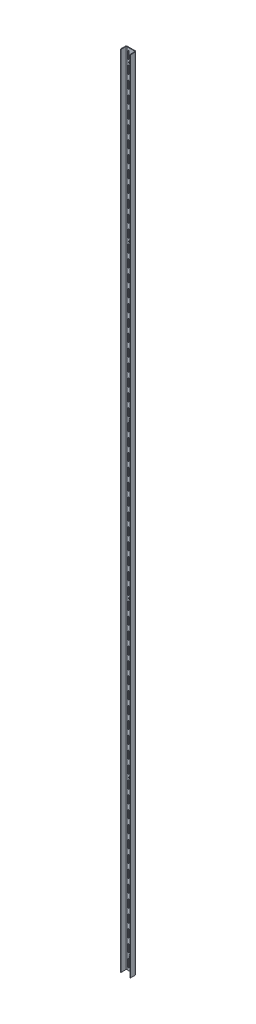
from build123d import *
from build123d.topology import SkipClean

# Parameters (mm, degrees)
BOSS_EXTRUDE1_DEPTH = 1984
CUT_EXTRUDE1_DEPTH  = 1985.096078823
CUT_EXTRUDE2_DEPTH  = 1985.096078823
BOSS_EXTRUDE2_DEPTH = 2
FILLET3_R           = 2
LPATTERN1_COUNT     = 62
LPATTERN1_PITCH     = 32
LPATTERN4_ANGLE     = 180
LPATTERN4_2_ANGLE   = 180
LPATTERN4_3_ANGLE   = 180
LPATTERN4_4_ANGLE   = 180
LPATTERN4_5_ANGLE   = 180
LPATTERN4_6_ANGLE   = 180
LPATTERN4_7_ANGLE   = 180
LPATTERN4_8_ANGLE   = 180
LPATTERN4_9_ANGLE   = 180
LPATTERN4_10_ANGLE  = 180


with BuildPart() as part:
    # Sketch1 → Boss-Extrude1 (new body)
    with BuildSketch(Plane(origin=(0, 0, 0), x_dir=(1, 0, 0), z_dir=(0, 1, 0))):
        with BuildLine():
            Line((11, -15), (11, -3))
            ThreePointArc((11, -3), (10.560660172, -1.939339828), (9.5, -1.5))
            Line((9.5, -1.5), (0, -1.5))
            Line((0, -1.5), (0, 0))
            Line((0, 0), (9.5, 0))
            ThreePointArc((9.5, 0), (11.621320344, -0.878679656), (12.5, -3))
            Line((12.5, -3), (12.5, -15))
            Line((12.5, -15), (11, -15))
        make_face()
    extrude(amount=BOSS_EXTRUDE1_DEPTH)

    # Sketch2 → Cut-Extrude1 (cut, through all)
    with BuildSketch(Plane.XY):
        with BuildLine():
            Line((4, 24.5), (4, 7.5))
            ThreePointArc((4, 7.5), (5.5, 6), (7, 7.5))
            Line((7, 7.5), (7, 24.5))
            ThreePointArc((7, 24.5), (5.5, 26), (4, 24.5))
        make_face()
    cut_extrude1 = extrude(amount=CUT_EXTRUDE1_DEPTH, mode=Mode.SUBTRACT)

    # Sketch2<3> → Cut-Extrude2 (cut, through all)
    with BuildSketch(Plane.XY):
        with BuildLine():
            ThreePointArc((0, 29.25), (2.75, 32), (0, 34.75))
            Line((0, 34.75), (0, 29.25))
        make_face()
    extrude(amount=CUT_EXTRUDE2_DEPTH, mode=Mode.SUBTRACT)

    # Sketch2<4> → Boss-Extrude2 (add)
    with BuildSketch(Plane.XY):
        with BuildLine():
            ThreePointArc((0, 27.75), (4.25, 32), (0, 36.25))
            Line((0, 36.25), (0, 34.75))
            ThreePointArc((0, 34.75), (2.75, 32), (0, 29.25))
            Line((0, 29.25), (0, 27.75))
        make_face()
    extrude(amount=BOSS_EXTRUDE2_DEPTH)

    # Fillet3
    # the kernel refuses this fillet: 2 mm, written as the material it adds along each edge
    with BuildSketch(Plane(origin=(0, 32, 1.5), x_dir=(0, 1, 0), z_dir=(-1, 0, 0))) as fillet3_piece_1:
        with BuildLine():
            CenterArc((5.572875656, -2), FILLET3_R, 90, 41.409622109)
            Line((5.572875656, 0), (4.25, 0))
            Line((4.25, 0), (4.25, -0.5))
        make_face()
    revolve(axis=Axis((0, 32, 1.5), (0, 0, -1)), revolution_arc=180)
    # the kernel refuses this fillet: 2 mm, written as the material it takes off along each edge
    with BuildSketch(Plane(origin=(0, 32, 0), x_dir=(-0.9999950652018582, -0.00314158748587966, 0), z_dir=(-0.00314158748587966, 0.9999950652018582, 0))) as fillet3_2_piece_1:
        with BuildLine():
            CenterArc((2.75 + FILLET3_R, FILLET3_R), FILLET3_R, 180, 90)
            Line((2.75, FILLET3_R), (2.75, 0))
            Line((2.75, 0), (2.75 + FILLET3_R, 0))
        make_face()
    revolve(axis=Axis((0, 32, 0), (0, 0, 1)), revolution_arc=359.64, mode=Mode.SUBTRACT)

    # LPattern1: Cut-Extrude1 ×62
    with Locations(*[(0, i * LPATTERN1_PITCH, 0) for i in range(1, LPATTERN1_COUNT)]):
        add(cut_extrude1, mode=Mode.SUBTRACT)

    # LPattern4: read off the stored shape, not the designer's step
    # LPattern4 outline → LPattern4 (revolve)
    with BuildSketch(Plane(origin=(0, 416, 0), x_dir=(0, -1, 0), z_dir=(-1, 0, 0))):
        with BuildLine():
            ThreePointArc((5.572875656, 1.5), (4.865768875, 1.629171307), (4.25, 2))
            Line((4.25, 2), (2.75, 2))
            ThreePointArc((2.75, 2), (2.765940608, 1.747991415), (2.813508327, 1.5))
            Line((2.813508327, 1.5), (5.572875656, 1.5))
        make_face()
    revolve(axis=Axis((0, 416, 0), (0, 0, 1)), revolution_arc=LPATTERN4_ANGLE)

    # LPattern4 2 outline → LPattern4 2 (revolve)
    with BuildSketch(Plane(origin=(0, 800, 0), x_dir=(0, -1, 0), z_dir=(-1, 0, 0))):
        with BuildLine():
            ThreePointArc((5.572875656, 1.5), (4.865768875, 1.629171307), (4.25, 2))
            Line((4.25, 2), (2.75, 2))
            ThreePointArc((2.75, 2), (2.765940608, 1.747991415), (2.813508327, 1.5))
            Line((2.813508327, 1.5), (5.572875656, 1.5))
        make_face()
    revolve(axis=Axis((0, 800, 0), (0, 0, 1)), revolution_arc=LPATTERN4_2_ANGLE)

    # LPattern4 3 outline → LPattern4 3 (revolve)
    with BuildSketch(Plane(origin=(0, 1184, 0), x_dir=(0, -1, 0), z_dir=(-1, 0, 0))):
        with BuildLine():
            ThreePointArc((5.572875656, 1.5), (4.865768875, 1.629171307), (4.25, 2))
            Line((4.25, 2), (2.75, 2))
            ThreePointArc((2.75, 2), (2.765940608, 1.747991415), (2.813508327, 1.5))
            Line((2.813508327, 1.5), (5.572875656, 1.5))
        make_face()
    revolve(axis=Axis((0, 1184, 0), (0, 0, 1)), revolution_arc=LPATTERN4_3_ANGLE)

    # LPattern4 4 outline → LPattern4 4 (revolve)
    with BuildSketch(Plane(origin=(0, 1568, 0), x_dir=(0, -1, 0), z_dir=(-1, 0, 0))):
        with BuildLine():
            ThreePointArc((5.572875656, 1.5), (4.865768875, 1.629171307), (4.25, 2))
            Line((4.25, 2), (2.75, 2))
            ThreePointArc((2.75, 2), (2.765940608, 1.747991415), (2.813508327, 1.5))
            Line((2.813508327, 1.5), (5.572875656, 1.5))
        make_face()
    revolve(axis=Axis((0, 1568, 0), (0, 0, 1)), revolution_arc=LPATTERN4_4_ANGLE)

    # LPattern4 5 outline → LPattern4 5 (revolve)
    with BuildSketch(Plane(origin=(0, 1952, 0), x_dir=(0, -1, 0), z_dir=(-1, 0, 0))):
        with BuildLine():
            ThreePointArc((5.572875656, 1.5), (4.865768875, 1.629171307), (4.25, 2))
            Line((4.25, 2), (2.75, 2))
            ThreePointArc((2.75, 2), (2.765940608, 1.747991415), (2.813508327, 1.5))
            Line((2.813508327, 1.5), (5.572875656, 1.5))
        make_face()
    revolve(axis=Axis((0, 1952, 0), (0, 0, 1)), revolution_arc=LPATTERN4_5_ANGLE)

    # LPattern4 6 outline → LPattern4 6 (revolve, cut)
    with BuildSketch(Plane(origin=(0, 416, 0), x_dir=(0, -1, 0), z_dir=(-1, 0, 0))):
        with BuildLine():
            ThreePointArc((4.75, 0), (3.525255129, 0.41886117), (2.813508327, 1.5))
            Line((2.813508327, 1.5), (0, 1.5))
            Line((0, 1.5), (0, 0))
            Line((0, 0), (4.75, 0))
        make_face()
    revolve(axis=Axis((0, 416, 0), (0, 0, 1)), revolution_arc=LPATTERN4_6_ANGLE, mode=Mode.SUBTRACT)

    # LPattern4 7 outline → LPattern4 7 (revolve, cut)
    with BuildSketch(Plane(origin=(0, 800, 0), x_dir=(0, -1, 0), z_dir=(-1, 0, 0))):
        with BuildLine():
            ThreePointArc((4.75, 0), (3.525255129, 0.41886117), (2.813508327, 1.5))
            Line((2.813508327, 1.5), (0, 1.5))
            Line((0, 1.5), (0, 0))
            Line((0, 0), (4.75, 0))
        make_face()
    revolve(axis=Axis((0, 800, 0), (0, 0, 1)), revolution_arc=LPATTERN4_7_ANGLE, mode=Mode.SUBTRACT)

    # LPattern4 8 outline → LPattern4 8 (revolve, cut)
    with BuildSketch(Plane(origin=(0, 1184, 0), x_dir=(0, -1, 0), z_dir=(-1, 0, 0))):
        with BuildLine():
            ThreePointArc((4.75, 0), (3.525255129, 0.41886117), (2.813508327, 1.5))
            Line((2.813508327, 1.5), (0, 1.5))
            Line((0, 1.5), (0, 0))
            Line((0, 0), (4.75, 0))
        make_face()
    revolve(axis=Axis((0, 1184, 0), (0, 0, 1)), revolution_arc=LPATTERN4_8_ANGLE, mode=Mode.SUBTRACT)

    # LPattern4 9 outline → LPattern4 9 (revolve, cut)
    with BuildSketch(Plane(origin=(0, 1568, 0), x_dir=(0, -1, 0), z_dir=(-1, 0, 0))):
        with BuildLine():
            ThreePointArc((4.75, 0), (3.525255129, 0.41886117), (2.813508327, 1.5))
            Line((2.813508327, 1.5), (0, 1.5))
            Line((0, 1.5), (0, 0))
            Line((0, 0), (4.75, 0))
        make_face()
    revolve(axis=Axis((0, 1568, 0), (0, 0, 1)), revolution_arc=LPATTERN4_9_ANGLE, mode=Mode.SUBTRACT)

    # LPattern4 10 outline → LPattern4 10 (revolve, cut)
    with BuildSketch(Plane(origin=(0, 1952, 0), x_dir=(0, -1, 0), z_dir=(-1, 0, 0))):
        with BuildLine():
            ThreePointArc((4.75, 0), (3.525255129, 0.41886117), (2.813508327, 1.5))
            Line((2.813508327, 1.5), (0, 1.5))
            Line((0, 1.5), (0, 0))
            Line((0, 0), (4.75, 0))
        make_face()
    revolve(axis=Axis((0, 1952, 0), (0, 0, 1)), revolution_arc=LPATTERN4_10_ANGLE, mode=Mode.SUBTRACT)

    # Mirror1: part across plane


with BuildPart() as part_1:
    with SkipClean():  # the faces are left unmerged after this step: merging them gives an invalid solid
        add(part.part)
        add(part.part.mirror(Plane(origin=(0, 1984, 1.5), x_dir=(0, 0, 1), z_dir=(1, 0, 0))))


solid = part_1.part
